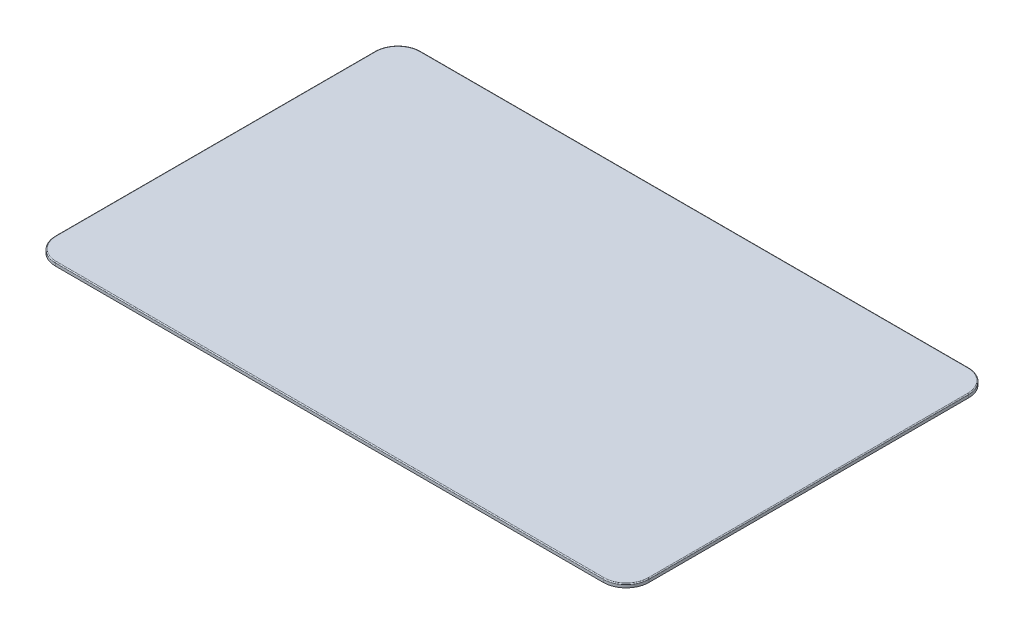
from build123d import *

# Parameters (mm, degrees)
EXTRUDE_1_DEPTH     = 8
FILLET_1_R          = 2
CUT_EXTRUDE_1_DEPTH = 6


with BuildPart() as part:
    # Эскиз1 → Бобышка-Вытянуть1 (new body)
    with BuildSketch(Plane(origin=(0, 0, 0), x_dir=(1, 0, 0), z_dir=(0, 1, 0))):
        with BuildLine():
            Line((-600, -400), (600, -400))
            ThreePointArc((600, -400), (635.355339059, -385.355339059), (650, -350))
            Line((650, -350), (650, 350))
            ThreePointArc((650, 350), (635.355339059, 385.355339059), (600, 400))
            Line((600, 400), (-600, 400))
            ThreePointArc((-600, 400), (-635.355339059, 385.355339059), (-650, 350))
            Line((-650, 350), (-650, -350))
            ThreePointArc((-650, -350), (-635.355339059, -385.355339059), (-600, -400))
        make_face()
    extrude(amount=EXTRUDE_1_DEPTH)

    # Скругление1
    fillet_1_edges = [part.edges().sort_by_distance(p)[0] for p in [
        (-635.355339059, 8, -385.355339059),
        (0, 8, -400),
        (635.355339059, 8, -385.355339059),
        (650, 8, 0),
        (635.355339059, 8, 385.355339059),
        (0, 8, 400),
        (-635.355339059, 8, 385.355339059),
        (-650, 8, 0),
    ]]
    fillet(fillet_1_edges, radius=FILLET_1_R)

    # Эскиз2 → Вырез-Вытянуть1 (cut)
    with BuildSketch(Plane.XZ):
        with BuildLine():
            ThreePointArc((-510.5, -113.713883744), (-509.035533906, -117.24941765), (-505.5, -118.713883744))
            Line((-505.5, -118.713883744), (-423, -118.713883744))
            ThreePointArc((-423, -118.713883744), (-419.464466094, -117.24941765), (-418, -113.713883744))
            Line((-418, -113.713883744), (-418, -29.5))
            ThreePointArc((-418, -29.5), (-416.535533906, -25.964466094), (-413, -24.5))
            ThreePointArc((-413, -24.5), (-409.464466094, -23.035533906), (-408, -19.5))
            ThreePointArc((-408, -19.5), (-406.535533906, -15.964466094), (-403, -14.5))
            Line((-403, -14.5), (-297.5, -14.5))
            Line((-297.5, -14.5), (-297.5, -207.927682204))
            ThreePointArc((-297.5, -207.927682204), (-298.971774478, -211.470509418), (-302.520649868, -212.927639562))
            Line((-302.520649868, -212.927639562), (-307.759216244, -212.906004237))
            ThreePointArc((-307.759216244, -212.906004237), (-312.019645969, -211.120626595), (-310.269519857, -215.395657982))
            Line((-310.269519857, -215.395657982), (-310.538832295, -280.604342017))
            ThreePointArc((-310.538832295, -280.604342017), (-312.320570836, -284.868433457), (-308.049157229, -283.104320697))
            Line((-308.049157229, -283.104320697), (-262.240805077, -283.104320697))
            ThreePointArc((-262.240805077, -283.104320697), (-257.973038124, -284.87208765), (-259.740805077, -280.604320697))
            Line((-259.740805077, -280.604320697), (-259.740805077, -218.125013383))
            ThreePointArc((-259.740805077, -218.125013383), (-258.269030598, -214.582186169), (-254.720155209, -213.125056025))
            Line((-254.720155209, -213.125056025), (-249.999999999, -213.144550308))
            Line((-249.999999999, -213.144550308), (-245.27984479, -213.125056025))
            ThreePointArc((-245.27984479, -213.125056025), (-241.7309694, -214.582186169), (-240.259194922, -218.125013383))
            Line((-240.259194922, -218.125013383), (-240.259194922, -280.604320697))
            ThreePointArc((-240.259194922, -280.604320697), (-242.026961875, -284.87208765), (-237.759194922, -283.104320697))
            Line((-237.759194922, -283.104320697), (-191.95084277, -283.104320697))
            ThreePointArc((-191.95084277, -283.104320697), (-187.679429162, -284.868433457), (-189.461167704, -280.604342017))
            Line((-189.461167704, -280.604342017), (-189.730480142, -215.395657982))
            ThreePointArc((-189.730480142, -215.395657982), (-187.98035403, -211.120626595), (-192.240783755, -212.906004237))
            Line((-192.240783755, -212.906004237), (-197.479350131, -212.927639562))
            ThreePointArc((-197.479350131, -212.927639562), (-201.02822552, -211.470509418), (-202.499999999, -207.927682204))
            Line((-202.499999999, -207.927682204), (-202.499999999, -179.286116256))
            ThreePointArc((-202.499999999, -179.286116256), (-203.964466093, -175.75058235), (-207.499999999, -174.286116256))
            Line((-207.499999999, -174.286116256), (-265.499999999, -174.286116256))
            ThreePointArc((-265.499999999, -174.286116256), (-269.035533905, -172.821650162), (-270.499999999, -169.286116256))
            Line((-270.499999999, -169.286116256), (-270.499999999, 174.286116256))
            ThreePointArc((-270.499999999, 174.286116256), (-269.035533905, 177.821650162), (-265.499999999, 179.286116256))
            Line((-265.499999999, 179.286116256), (-207.499999999, 179.286116256))
            ThreePointArc((-207.499999999, 179.286116256), (-203.964466093, 180.75058235), (-202.499999999, 184.286116256))
            Line((-202.499999999, 184.286116256), (-202.499999999, 207.927682204))
            ThreePointArc((-202.499999999, 207.927682204), (-201.02822552, 211.470509418), (-197.479350131, 212.927639562))
            Line((-197.479350131, 212.927639562), (-192.240783755, 212.906004237))
            ThreePointArc((-192.240783755, 212.906004237), (-187.98035403, 211.120626595), (-189.730480142, 215.395657982))
            Line((-189.730480142, 215.395657982), (-189.461167704, 280.604342017))
            ThreePointArc((-189.461167704, 280.604342017), (-187.679429162, 284.868433457), (-191.95084277, 283.104320697))
            Line((-191.95084277, 283.104320697), (-237.759194922, 283.104320697))
            ThreePointArc((-237.759194922, 283.104320697), (-242.026961875, 284.87208765), (-240.259194922, 280.604320697))
            Line((-240.259194922, 280.604320697), (-240.259194922, 218.104320697))
            ThreePointArc((-240.259194922, 218.104320697), (-241.723661016, 214.568786791), (-245.259194922, 213.104320697))
            Line((-245.259194922, 213.104320697), (-254.740805077, 213.104320697))
            ThreePointArc((-254.740805077, 213.104320697), (-258.276338983, 214.568786791), (-259.740805077, 218.104320697))
            Line((-259.740805077, 218.104320697), (-259.740805077, 280.604320697))
            ThreePointArc((-259.740805077, 280.604320697), (-257.973038124, 284.87208765), (-262.240805077, 283.104320697))
            Line((-262.240805077, 283.104320697), (-308.049157229, 283.104320697))
            ThreePointArc((-308.049157229, 283.104320697), (-312.320570836, 284.868433457), (-310.538832295, 280.604342017))
            Line((-310.538832295, 280.604342017), (-310.269519857, 215.395657982))
            ThreePointArc((-310.269519857, 215.395657982), (-312.019645969, 211.120626595), (-307.759216244, 212.906004237))
            Line((-307.759216244, 212.906004237), (-302.520649868, 212.927639562))
            ThreePointArc((-302.520649868, 212.927639562), (-298.971774478, 211.470509418), (-297.5, 207.927682204))
            Line((-297.5, 207.927682204), (-297.5, 14.5))
            Line((-297.5, 14.5), (-403, 14.5))
            ThreePointArc((-403, 14.5), (-406.535533906, 15.964466094), (-408, 19.5))
            ThreePointArc((-408, 19.5), (-409.464466094, 23.035533906), (-413, 24.5))
            ThreePointArc((-413, 24.5), (-416.535533906, 25.964466094), (-418, 29.5))
            Line((-418, 29.5), (-418, 113.713883744))
            ThreePointArc((-418, 113.713883744), (-419.464466094, 117.24941765), (-423, 118.713883744))
            Line((-423, 118.713883744), (-505.5, 118.713883744))
            ThreePointArc((-505.5, 118.713883744), (-509.035533906, 117.24941765), (-510.5, 113.713883744))
            Line((-510.5, 113.713883744), (-510.5, 85.072317796))
            ThreePointArc((-510.5, 85.072317796), (-511.971774479, 81.529490582), (-515.520649868, 80.072360438))
            Line((-515.520649868, 80.072360438), (-520.759216244, 80.093995763))
            ThreePointArc((-520.759216244, 80.093995763), (-525.019645969, 81.879373405), (-523.269519857, 77.604342018))
            Line((-523.269519857, 77.604342018), (-523.538832295, 12.395657982))
            ThreePointArc((-523.538832295, 12.395657982), (-525.320570836, 8.131566542), (-521.049157229, 9.895679303))
            Line((-521.049157229, 9.895679303), (-475.240805077, 9.895679303))
            ThreePointArc((-475.240805077, 9.895679303), (-470.973038124, 8.12791235), (-472.740805077, 12.395679303))
            Line((-472.740805077, 12.395679303), (-472.740805077, 77.395679303))
            ThreePointArc((-472.740805077, 77.395679303), (-470.96939147, 81.659792064), (-475.240783756, 79.906004237))
            Line((-475.240783756, 79.906004237), (-480.520649868, 79.92781013))
            ThreePointArc((-480.520649868, 79.92781013), (-484.042827214, 81.399541967), (-485.5, 84.927767488))
            Line((-485.5, 84.927767488), (-485.5, 88.713883744))
            ThreePointArc((-485.5, 88.713883744), (-484.035533906, 92.24941765), (-480.5, 93.713883744))
            Line((-480.5, 93.713883744), (-448, 93.713883744))
            ThreePointArc((-448, 93.713883744), (-444.464466094, 92.24941765), (-443, 88.713883744))
            Line((-443, 88.713883744), (-443, -88.713883744))
            ThreePointArc((-443, -88.713883744), (-444.464466094, -92.24941765), (-448, -93.713883744))
            Line((-448, -93.713883744), (-480.5, -93.713883744))
            ThreePointArc((-480.5, -93.713883744), (-484.035533906, -92.24941765), (-485.5, -88.713883744))
            Line((-485.5, -88.713883744), (-485.5, -84.927767488))
            ThreePointArc((-485.5, -84.927767488), (-484.042827214, -81.399541967), (-480.520649868, -79.92781013))
            Line((-480.520649868, -79.92781013), (-475.240783756, -79.906004237))
            ThreePointArc((-475.240783756, -79.906004237), (-470.96939147, -81.659792064), (-472.740805077, -77.395679303))
            Line((-472.740805077, -77.395679303), (-472.740805077, -12.395679303))
            ThreePointArc((-472.740805077, -12.395679303), (-470.973038124, -8.12791235), (-475.240805077, -9.895679303))
            Line((-475.240805077, -9.895679303), (-521.049157229, -9.895679303))
            ThreePointArc((-521.049157229, -9.895679303), (-525.320570836, -8.131566542), (-523.538832295, -12.395657982))
            Line((-523.538832295, -12.395657982), (-523.269519857, -77.604342018))
            ThreePointArc((-523.269519857, -77.604342018), (-525.019645969, -81.879373405), (-520.759216244, -80.093995763))
            Line((-520.759216244, -80.093995763), (-515.520649868, -80.072360438))
            ThreePointArc((-515.520649868, -80.072360438), (-511.971774479, -81.529490582), (-510.5, -85.072317796))
            Line((-510.5, -85.072317796), (-510.5, -113.713883744))
        make_face()
        with BuildLine():
            Line((307.759216244, -212.906004237), (302.520649868, -212.927639562))
            ThreePointArc((302.520649868, -212.927639562), (298.971774478, -211.470509418), (297.5, -207.927682204))
            Line((297.5, -207.927682204), (297.5, -19.5))
            ThreePointArc((297.5, -19.5), (298.964466094, -15.964466094), (302.5, -14.5))
            Line((302.5, -14.5), (403, -14.5))
            ThreePointArc((403, -14.5), (406.535533906, -15.964466094), (408, -19.5))
            ThreePointArc((408, -19.5), (409.464466094, -23.035533906), (413, -24.5))
            ThreePointArc((413, -24.5), (416.535533906, -25.964466094), (418, -29.5))
            Line((418, -29.5), (418, -113.713883744))
            ThreePointArc((418, -113.713883744), (419.464466094, -117.24941765), (423, -118.713883744))
            Line((423, -118.713883744), (505.5, -118.713883744))
            ThreePointArc((505.5, -118.713883744), (509.035533906, -117.24941765), (510.5, -113.713883744))
            Line((510.5, -113.713883744), (510.5, -85.072317796))
            ThreePointArc((510.5, -85.072317796), (511.971774479, -81.529490582), (515.520649868, -80.072360438))
            Line((515.520649868, -80.072360438), (520.759216244, -80.093995763))
            ThreePointArc((520.759216244, -80.093995763), (525.019645969, -81.879373405), (523.269519857, -77.604342018))
            Line((523.269519857, -77.604342018), (523.538832295, -12.395657982))
            ThreePointArc((523.538832295, -12.395657982), (525.320570836, -8.131566542), (521.049157229, -9.895679303))
            Line((521.049157229, -9.895679303), (475.240805077, -9.895679303))
            ThreePointArc((475.240805077, -9.895679303), (470.973038124, -8.12791235), (472.740805077, -12.395679303))
            Line((472.740805077, -12.395679303), (472.740805077, -77.395679303))
            ThreePointArc((472.740805077, -77.395679303), (470.96939147, -81.659792064), (475.240783756, -79.906004237))
            Line((475.240783756, -79.906004237), (480.520649868, -79.92781013))
            ThreePointArc((480.520649868, -79.92781013), (484.042827214, -81.399541967), (485.5, -84.927767488))
            Line((485.5, -84.927767488), (485.5, -88.713883744))
            ThreePointArc((485.5, -88.713883744), (484.035533906, -92.24941765), (480.5, -93.713883744))
            Line((480.5, -93.713883744), (448, -93.713883744))
            ThreePointArc((448, -93.713883744), (444.464466094, -92.24941765), (443, -88.713883744))
            Line((443, -88.713883744), (443, 88.713883744))
            ThreePointArc((443, 88.713883744), (444.464466094, 92.24941765), (448, 93.713883744))
            Line((448, 93.713883744), (480.5, 93.713883744))
            ThreePointArc((480.5, 93.713883744), (484.035533906, 92.24941765), (485.5, 88.713883744))
            Line((485.5, 88.713883744), (485.5, 84.927767488))
            ThreePointArc((485.5, 84.927767488), (484.042827214, 81.399541967), (480.520649868, 79.92781013))
            Line((480.520649868, 79.92781013), (475.240783756, 79.906004237))
            ThreePointArc((475.240783756, 79.906004237), (470.96939147, 81.659792064), (472.740805077, 77.395679303))
            Line((472.740805077, 77.395679303), (472.740805077, 12.395679303))
            ThreePointArc((472.740805077, 12.395679303), (470.973038124, 8.12791235), (475.240805077, 9.895679303))
            Line((475.240805077, 9.895679303), (521.049157229, 9.895679303))
            ThreePointArc((521.049157229, 9.895679303), (525.320570836, 8.131566542), (523.538832295, 12.395657982))
            Line((523.538832295, 12.395657982), (523.269519857, 77.604342018))
            ThreePointArc((523.269519857, 77.604342018), (525.019645969, 81.879373405), (520.759216244, 80.093995763))
            Line((520.759216244, 80.093995763), (515.520649868, 80.072360438))
            ThreePointArc((515.520649868, 80.072360438), (511.971774479, 81.529490582), (510.5, 85.072317796))
            Line((510.5, 85.072317796), (510.5, 113.713883744))
            ThreePointArc((510.5, 113.713883744), (509.035533906, 117.24941765), (505.5, 118.713883744))
            Line((505.5, 118.713883744), (423, 118.713883744))
            ThreePointArc((423, 118.713883744), (419.464466094, 117.24941765), (418, 113.713883744))
            Line((418, 113.713883744), (418, 29.5))
            ThreePointArc((418, 29.5), (416.535533906, 25.964466094), (413, 24.5))
            ThreePointArc((413, 24.5), (409.464466094, 23.035533906), (408, 19.5))
            ThreePointArc((408, 19.5), (406.535533906, 15.964466094), (403, 14.5))
            Line((403, 14.5), (302.5, 14.5))
            ThreePointArc((302.5, 14.5), (298.964466094, 15.964466094), (297.5, 19.5))
            Line((297.5, 19.5), (297.5, 207.927682204))
            ThreePointArc((297.5, 207.927682204), (298.971774478, 211.470509418), (302.520649868, 212.927639562))
            Line((302.520649868, 212.927639562), (307.759216244, 212.906004237))
            ThreePointArc((307.759216244, 212.906004237), (312.019645969, 211.120626595), (310.269519857, 215.395657982))
            Line((310.269519857, 215.395657982), (310.538832295, 280.604342017))
            ThreePointArc((310.538832295, 280.604342017), (312.320570836, 284.868433457), (308.049157229, 283.104320697))
            Line((308.049157229, 283.104320697), (262.240805077, 283.104320697))
            ThreePointArc((262.240805077, 283.104320697), (257.973038124, 284.87208765), (259.740805077, 280.604320697))
            Line((259.740805077, 280.604320697), (259.740805077, 218.125013383))
            ThreePointArc((259.740805077, 218.125013383), (258.269030598, 214.582186169), (254.720155209, 213.125056025))
            Line((254.720155209, 213.125056025), (249.999999999, 213.144550308))
            Line((249.999999999, 213.144550308), (245.27984479, 213.125056025))
            ThreePointArc((245.27984479, 213.125056025), (241.7309694, 214.582186169), (240.259194922, 218.125013383))
            Line((240.259194922, 218.125013383), (240.259194922, 280.604320697))
            ThreePointArc((240.259194922, 280.604320697), (242.026961875, 284.87208765), (237.759194922, 283.104320697))
            Line((237.759194922, 283.104320697), (191.95084277, 283.104320697))
            ThreePointArc((191.95084277, 283.104320697), (187.679429162, 284.868433457), (189.461167704, 280.604342017))
            Line((189.461167704, 280.604342017), (189.730480142, 215.395657982))
            ThreePointArc((189.730480142, 215.395657982), (187.98035403, 211.120626595), (192.240783755, 212.906004237))
            Line((192.240783755, 212.906004237), (197.479350131, 212.927639562))
            ThreePointArc((197.479350131, 212.927639562), (201.02822552, 211.470509418), (202.499999999, 207.927682204))
            Line((202.499999999, 207.927682204), (202.499999999, 179.286116256))
            ThreePointArc((202.499999999, 179.286116256), (203.964466093, 175.75058235), (207.499999999, 174.286116256))
            Line((207.499999999, 174.286116256), (265.499999999, 174.286116256))
            ThreePointArc((265.499999999, 174.286116256), (269.035533905, 172.821650162), (270.499999999, 169.286116256))
            Line((270.499999999, 169.286116256), (270.499999999, -174.286116256))
            ThreePointArc((270.499999999, -174.286116256), (269.035533905, -177.821650162), (265.499999999, -179.286116256))
            Line((265.499999999, -179.286116256), (207.499999999, -179.286116256))
            ThreePointArc((207.499999999, -179.286116256), (203.964466093, -180.75058235), (202.499999999, -184.286116256))
            Line((202.499999999, -184.286116256), (202.499999999, -207.927682204))
            ThreePointArc((202.499999999, -207.927682204), (201.02822552, -211.470509418), (197.479350131, -212.927639562))
            Line((197.479350131, -212.927639562), (192.240783755, -212.906004237))
            ThreePointArc((192.240783755, -212.906004237), (187.98035403, -211.120626595), (189.730480142, -215.395657982))
            Line((189.730480142, -215.395657982), (189.461167704, -280.604342017))
            ThreePointArc((189.461167704, -280.604342017), (187.679429162, -284.868433457), (191.95084277, -283.104320697))
            Line((191.95084277, -283.104320697), (237.759194922, -283.104320697))
            ThreePointArc((237.759194922, -283.104320697), (242.026961875, -284.87208765), (240.259194922, -280.604320697))
            Line((240.259194922, -280.604320697), (240.259194922, -218.093995763))
            ThreePointArc((240.259194922, -218.093995763), (241.723661016, -214.558461857), (245.259194922, -213.093995763))
            Line((245.259194922, -213.093995763), (254.740805077, -213.093995763))
            ThreePointArc((254.740805077, -213.093995763), (258.276338983, -214.558461857), (259.740805077, -218.093995763))
            Line((259.740805077, -218.093995763), (259.740805077, -280.604320697))
            ThreePointArc((259.740805077, -280.604320697), (257.973038124, -284.87208765), (262.240805077, -283.104320697))
            Line((262.240805077, -283.104320697), (308.049157229, -283.104320697))
            ThreePointArc((308.049157229, -283.104320697), (312.320570836, -284.868433457), (310.538832295, -280.604342017))
            Line((310.538832295, -280.604342017), (310.269519857, -215.395657982))
            ThreePointArc((310.269519857, -215.395657982), (312.019645969, -211.120626595), (307.759216244, -212.906004237))
        make_face()
        with BuildLine():
            Line((145, -32.5), (145, 50))
            ThreePointArc((145, 50), (130.355339059, 85.355339059), (95, 100))
            Line((95, 100), (26, 100))
            ThreePointArc((26, 100), (22.464466094, 101.464466094), (21, 105))
            Line((21, 105), (21, 142.340673024))
            ThreePointArc((21, 142.340673024), (21.826494392, 145.094189129), (24.032740376, 146.937398987))
            ThreePointArc((24.032740376, 146.937398987), (28.405017729, 145.72175133), (26.5, 149.840673024))
            Line((26.5, 149.840673024), (26.5, 194.840673024))
            ThreePointArc((26.5, 194.840673024), (28.267766953, 199.108439977), (24, 197.340673024))
            Line((24, 197.340673024), (-21, 197.340673024))
            ThreePointArc((-21, 197.340673024), (-25.267766953, 199.108439977), (-23.5, 194.840673024))
            Line((-23.5, 194.840673024), (-23.5, 149.840673024))
            ThreePointArc((-23.5, 149.840673024), (-25.405017729, 145.72175133), (-21.032740376, 146.937398987))
            ThreePointArc((-21.032740376, 146.937398987), (-18.826494392, 145.094189129), (-18, 142.340673024))
            Line((-18, 142.340673024), (-18, 105))
            ThreePointArc((-18, 105), (-19.464466094, 101.464466094), (-23, 100))
            Line((-23, 100), (-95, 100))
            ThreePointArc((-95, 100), (-130.355339059, 85.355339059), (-145, 50))
            Line((-145, 50), (-145, -32.5))
            ThreePointArc((-145, -32.5), (-146.767766953, -36.767766953), (-142.5, -35))
            Line((-142.5, -35), (-97.5, -35))
            ThreePointArc((-97.5, -35), (-93.232233047, -36.767766953), (-95, -32.5))
            Line((-95, -32.5), (-95, 35))
            ThreePointArc((-95, 35), (-90, 40), (-85, 35))
            Line((-85, 35), (-85, -32.5))
            ThreePointArc((-85, -32.5), (-86.767766953, -36.767766953), (-82.5, -35))
            Line((-82.5, -35), (-37.5, -35))
            ThreePointArc((-37.5, -35), (-33.232233047, -36.767766953), (-35, -32.5))
            Line((-35, -32.5), (-35, 35))
            ThreePointArc((-35, 35), (-30, 40), (-25, 35))
            Line((-25, 35), (-25, -32.5))
            ThreePointArc((-25, -32.5), (-26.767766953, -36.767766953), (-22.5, -35))
            Line((-22.5, -35), (22.5, -35))
            ThreePointArc((22.5, -35), (26.767766953, -36.767766953), (25, -32.5))
            Line((25, -32.5), (25, 35))
            ThreePointArc((25, 35), (30, 40), (35, 35))
            Line((35, 35), (35, -32.5))
            ThreePointArc((35, -32.5), (33.232233047, -36.767766953), (37.5, -35))
            Line((37.5, -35), (82.5, -35))
            ThreePointArc((82.5, -35), (86.767766953, -36.767766953), (85, -32.5))
            Line((85, -32.5), (85, 35))
            ThreePointArc((85, 35), (90, 40), (95, 35))
            Line((95, 35), (95, -32.5))
            ThreePointArc((95, -32.5), (93.232233047, -36.767766953), (97.5, -35))
            Line((97.5, -35), (142.5, -35))
            ThreePointArc((142.5, -35), (146.767766953, -36.767766953), (145, -32.5))
        make_face()
    extrude(amount=-CUT_EXTRUDE_1_DEPTH, mode=Mode.SUBTRACT)


solid = part.part
